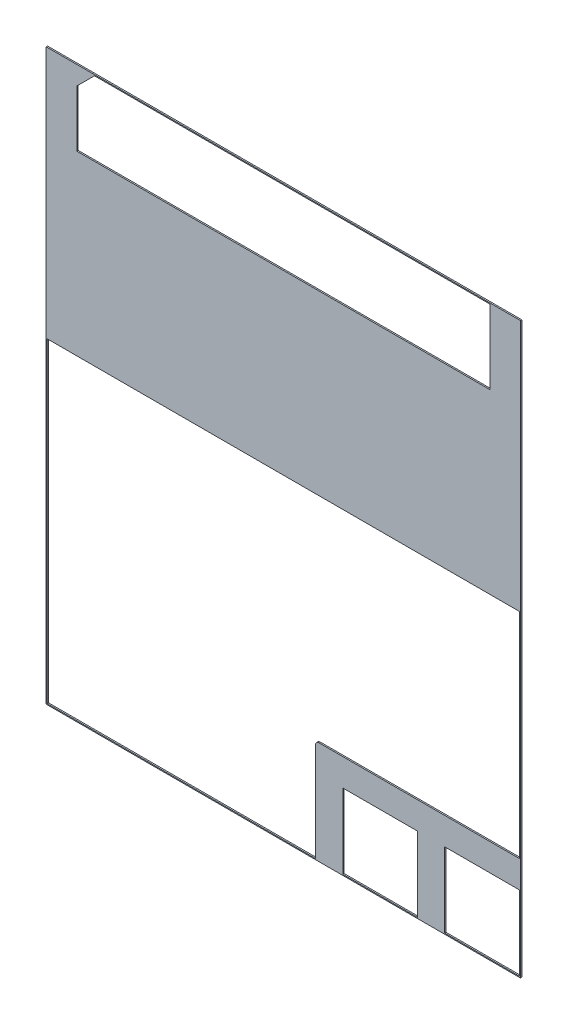
from build123d import *

# Parameters (mm, degrees)
SKETCH1_W           = 6.980000001
SKETCH1_H           = 8.380000002
SKETCH1_W_2         = 1.1
SKETCH1_H_2         = 1.1
BOSS_EXTRUDE1_DEPTH = 0.02


with BuildPart() as part:
    # Sketch1 → Boss-Extrude1 (new body)
    with BuildSketch(Plane(origin=(0, 0, 0), x_dir=(-1, 0, 0), z_dir=(0, 0, -1))):
        with Locations((-3.230000001, 4.190000001)):
            Rectangle(SKETCH1_W, SKETCH1_H)
        with Locations((-6.155, 0.565)):
            Rectangle(SKETCH1_W_2, SKETCH1_H_2, mode=Mode.SUBTRACT)
        with Locations((-4.655, 0.565)):
            Rectangle(SKETCH1_W_2, SKETCH1_H_2, mode=Mode.SUBTRACT)
        with BuildLine():
            Line((-3.755000001, 1.515), (-6.705, 1.515))
            Line((-6.705, 1.515), (-6.705, 4.665000002))
            Line((-6.705, 4.665000002), (0.245, 4.665000002))
            Line((0.245, 4.665000002), (0.245, 0.015))
            Line((0.245, 0.015), (-3.705000001, 0.015))
            Line((-3.705000001, 0.015), (-3.705000001, 1.465))
            ThreePointArc((-3.705000001, 1.465), (-3.719644662, 1.500355339), (-3.755000001, 1.515))
        make_face(mode=Mode.SUBTRACT)
        Polygon((-0.18999998, 8.105000002), (-0.18999998, 7.275000002), (-6.270000021, 7.275000002), (-6.270000021, 8.365000002), (-0.44999998, 8.365000002), align=None, mode=Mode.SUBTRACT)
    extrude(amount=-BOSS_EXTRUDE1_DEPTH)


solid = part.part
